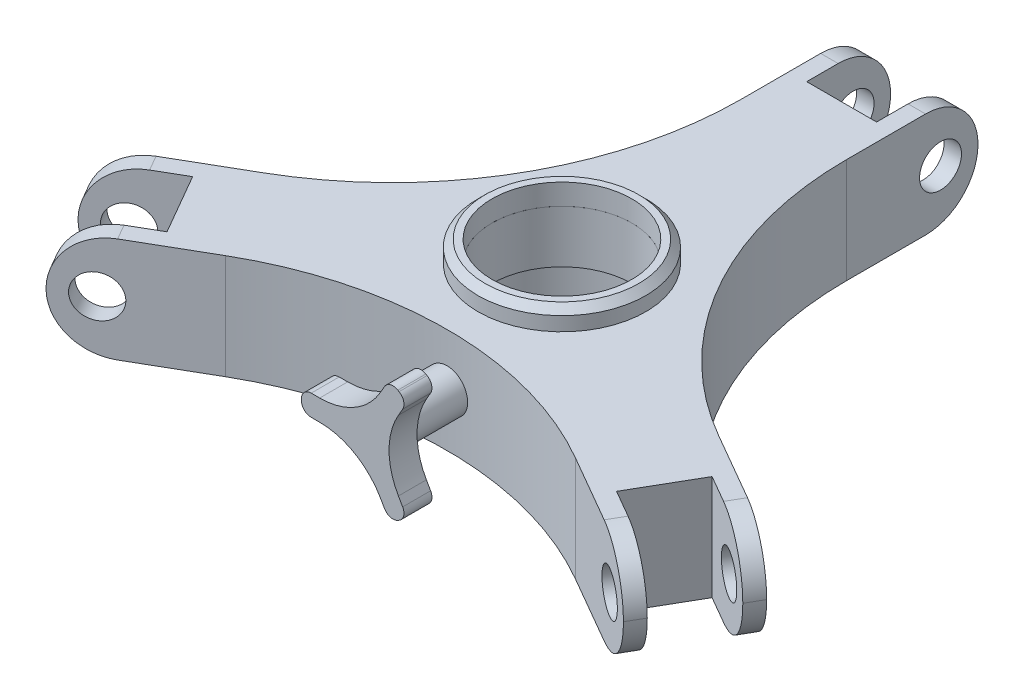
from build123d import *

# Parameters (mm, degrees)
BOSS_EXTRU_1_START           = -15
ESQUISSE2_R                  = 15
BOSS_EXTRU_1_DEPTH           = 15
CONG_1_R                     = 7.5
ENL_V_MAT_EXTRU_1_REACH      = 74.862
ESQUISSE3_W                  = 10
ESQUISSE3_H                  = 42.147578144
ESQUISSE4_R                  = 3
ENL_V_MAT_EXTRU_2_DEPTH      = 79.082086437
R_P_TITION_CIRCULAIRE5_COUNT = 3
ESQUISSE5_R                  = 3
BOSS_EXTRU_2_DEPTH           = 24
ESQUISSE6_R                  = 10
ENL_V_MAT_EXTRU_3_DEPTH      = 24
ENL_V_START                  = -7.5
ESQUISSE7_R                  = 12
ENL_V_MAT_EXTRU_5_DEPTH      = 7.5
BOSS_EXTRU_3_DEPTH           = 4
BOSS_EXTRU_5_START           = 3
ESQUISSE10_R                 = 12
ESQUISSE10_R_2               = 10
BOSS_EXTRU_5_DEPTH           = 3
CHANFREIN1_SIZE              = 1


with BuildPart() as part:
    # Esquisse1 → Révolution1 (revolve)
    with BuildSketch(Plane.XY, mode=Mode.PRIVATE) as r_volution1_sk:
        Polygon((-12, 0), (-12, 7.5), (-10, 7.5), (-10, 15), (-15, 15), (-15, 0), align=None)
    revolve(r_volution1_sk.sketch.rotate(Axis((0, 0, 0), (0, 1, 0)), 270), axis=Axis((0, 0, 0), (0, 1, 0)))

    # Esquisse2 → Boss.-Extru.1 (add)
    with BuildSketch(Plane(origin=(0, 15, 0), x_dir=(1, 0, 0), z_dir=(0, 1, 0)).offset(BOSS_EXTRU_1_START)):
        with BuildLine():
            Line((-7.5, 33.197640478), (-7.5, 52))
            Line((-7.5, 52), (7.5, 52))
            Line((7.5, 52), (7.5, 33.197640478))
            ThreePointArc((7.5, 33.197640478), (14.198729811, 8.197640478), (32.5, -10.103629711))
            Line((32.5, -10.103629711), (48.783320997, -19.504809472))
            Line((48.783320997, -19.504809472), (41.283320997, -32.495190528))
            Line((41.283320997, -32.495190528), (25, -23.094010768))
            ThreePointArc((25, -23.094010768), (0, -16.395280957), (-25, -23.094010768))
            Line((-25, -23.094010768), (-41.283320997, -32.495190528))
            Line((-41.283320997, -32.495190528), (-48.783320997, -19.504809472))
            Line((-48.783320997, -19.504809472), (-32.5, -10.103629711))
            ThreePointArc((-32.5, -10.103629711), (-14.198729811, 8.197640478), (-7.5, 33.197640478))
        make_face()
        Circle(ESQUISSE2_R, mode=Mode.SUBTRACT)
    extrude(amount=BOSS_EXTRU_1_DEPTH)

    # Congé1
    cong_1_edges = [part.edges().sort_by_distance(p)[0] for p in [
        (0, 0, -52),
        (0, 15, -52),
        (45.033320997, 0, 26),
        (45.033320997, 15, 26),
        (-45.033320997, 0, 26),
        (-45.033320997, 15, 26),
    ]]
    fillet(cong_1_edges, radius=CONG_1_R - 0.0001)  # a hair under: the kernel refuses the full size

    # Esquisse3 → Enlèv. mat.-Extru.1 (cut, up to next)
    with BuildSketch(Plane(origin=(0, 15, 0), x_dir=(1, 0, 0), z_dir=(0, 1, 0)), mode=Mode.PRIVATE) as enl_v_mat_extru_1_sk1:
        with Locations((0, 61.073789072)):
            Rectangle(ESQUISSE3_W, ESQUISSE3_H)
    enl_v_mat_extru_1_tool1 = extrude(enl_v_mat_extru_1_sk1.sketch, amount=-ENL_V_MAT_EXTRU_1_REACH, mode=Mode.PRIVATE) & part.part
    # Esquisse3 → Enlèv. mat.-Extru.1 (cut, up to next)
    with BuildSketch(Plane(origin=(0, 15, 0), x_dir=(1, 0, 0), z_dir=(0, 1, 0)), mode=Mode.PRIVATE) as enl_v_mat_extru_1_sk2:
        Polygon((32.141016151, -24.330127019), (37.141016151, -15.669872981), (73.641889532, -36.743662053), (68.641889532, -45.403916091), align=None)
    enl_v_mat_extru_1_tool2 = extrude(enl_v_mat_extru_1_sk2.sketch, amount=-ENL_V_MAT_EXTRU_1_REACH, mode=Mode.PRIVATE) & part.part
    # Esquisse3 → Enlèv. mat.-Extru.1 (cut, up to next)
    with BuildSketch(Plane(origin=(0, 15, 0), x_dir=(1, 0, 0), z_dir=(0, 1, 0)), mode=Mode.PRIVATE) as enl_v_mat_extru_1_sk3:
        Polygon((-37.141016151, -15.669872981), (-32.141016151, -24.330127019), (-68.641889532, -45.403916091), (-73.641889532, -36.743662053), align=None)
    enl_v_mat_extru_1_tool3 = extrude(enl_v_mat_extru_1_sk3.sketch, amount=-ENL_V_MAT_EXTRU_1_REACH, mode=Mode.PRIVATE) & part.part
    add(enl_v_mat_extru_1_tool1.solids().sort_by_distance((0, 15, -61.073789))[0], mode=Mode.SUBTRACT)
    add(enl_v_mat_extru_1_tool2.solids().sort_by_distance((52.891453, 15, 30.536895))[0], mode=Mode.SUBTRACT)
    add(enl_v_mat_extru_1_tool3.solids().sort_by_distance((-52.891453, 15, 30.536895))[0], mode=Mode.SUBTRACT)

    # Esquisse4 → Enlèv. mat.-Extru.2 (cut, through all)
    with BuildSketch(Plane(origin=(7.5, 0, 0), x_dir=(0, 0, -1), z_dir=(1, 0, 0))):
        with Locations((46.641012263, 7.5)):
            Circle(ESQUISSE4_R)
    enl_v_mat_extru_2 = extrude(amount=-ENL_V_MAT_EXTRU_2_DEPTH, mode=Mode.SUBTRACT)

    # Répétition circulaire5: Enlèv. mat.-Extru.2 ×3 about axis
    r_p_tition_circulaire5_axis = Axis((0, 0, 0), (0, 1, 0))
    for i in range(1, R_P_TITION_CIRCULAIRE5_COUNT):
        add(enl_v_mat_extru_2.rotate(r_p_tition_circulaire5_axis, i * 360 / R_P_TITION_CIRCULAIRE5_COUNT), mode=Mode.SUBTRACT)

    # Esquisse5 → Boss.-Extru.2 (add)
    with BuildSketch(Plane.XY):
        with Locations(Location((0, 7.5, 0), (0, 0, 180))):
            Circle(ESQUISSE5_R)
    extrude(amount=BOSS_EXTRU_2_DEPTH)

    # Esquisse6 → Enlèv. mat.-Extru.3 (cut)
    with BuildSketch(Plane(origin=(0, 15, 0), x_dir=(1, 0, 0), z_dir=(0, 1, 0))):
        with Locations(Location((0, 0, 0), (0, 0, 90))):
            Circle(ESQUISSE6_R)
    extrude(amount=-ENL_V_MAT_EXTRU_3_DEPTH, mode=Mode.SUBTRACT)

    # Esquisse7 → Enlèv. mat.-Extru.5 (cut)
    with BuildSketch(Plane.XZ.offset(ENL_V_START)):
        with Locations(Location((0, 0, 0), (0, 0, 270))):
            Circle(ESQUISSE7_R)
    extrude(amount=ENL_V_MAT_EXTRU_5_DEPTH, mode=Mode.SUBTRACT)


with BuildPart() as body_2:
    # Esquisse8 → Boss.-Extru.3 (new body)
    with BuildSketch(Plane.XY.offset(24)):
        with BuildLine():
            Line((-6.639528096, 6), (-7.853404144, 6))
            ThreePointArc((-7.853404144, 6), (-8.843353638, 6.410050506), (-9.253404144, 7.4))
            Line((-9.253404144, 7.4), (-9.253404144, 7.6))
            ThreePointArc((-9.253404144, 7.6), (-8.843353638, 8.589949494), (-7.853404144, 9))
            Line((-7.853404144, 9), (-6.639528096, 9))
            ThreePointArc((-6.639528096, 9), (-1.639528096, 10.339745962), (2.020725942, 14))
            Line((2.020725942, 14), (2.627663966, 15.051247495))
            ThreePointArc((2.627663966, 15.051247495), (3.477752868, 15.703543652), (4.540099532, 15.56368306))
            Line((4.540099532, 15.56368306), (4.713304612, 15.46368306))
            ThreePointArc((4.713304612, 15.46368306), (5.365600769, 14.613594158), (5.225740178, 13.551247495))
            Line((5.225740178, 13.551247495), (4.618802154, 12.5))
            ThreePointArc((4.618802154, 12.5), (3.279056191, 7.5), (4.618802154, 2.5))
            Line((4.618802154, 2.5), (5.225740178, 1.448752505))
            ThreePointArc((5.225740178, 1.448752505), (5.365600769, 0.386405842), (4.713304612, -0.46368306))
            Line((4.713304612, -0.46368306), (4.540099532, -0.56368306))
            ThreePointArc((4.540099532, -0.56368306), (3.477752868, -0.703543652), (2.627663966, -0.051247495))
            Line((2.627663966, -0.051247495), (2.020725942, 1))
            ThreePointArc((2.020725942, 1), (-1.639528096, 4.660254038), (-6.639528096, 6))
        make_face()
    extrude(amount=BOSS_EXTRU_3_DEPTH)


with BuildPart() as body_3:
    # Esquisse10 → Boss.-Extru.5 (new body)
    with BuildSketch(Plane(origin=(0, 15, 0), x_dir=(1, 0, 0), z_dir=(0, 1, 0)).offset(BOSS_EXTRU_5_START)):
        with Locations(Location((0, 0, 0), (0, 0, 270))):
            Circle(ESQUISSE10_R)
        with Locations(Location((0, 0, 0), (0, 0, 270))):
            Circle(ESQUISSE10_R_2, mode=Mode.SUBTRACT)
    extrude(amount=-BOSS_EXTRU_5_DEPTH)

    # Chanfrein1
    chanfrein1_edges = [body_3.edges().sort_by_distance(p)[0] for p in [
        (0, 18, -12),
    ]]
    chamfer(chanfrein1_edges, length=CHANFREIN1_SIZE)


solid = Compound([part.part, body_2.part, body_3.part])
